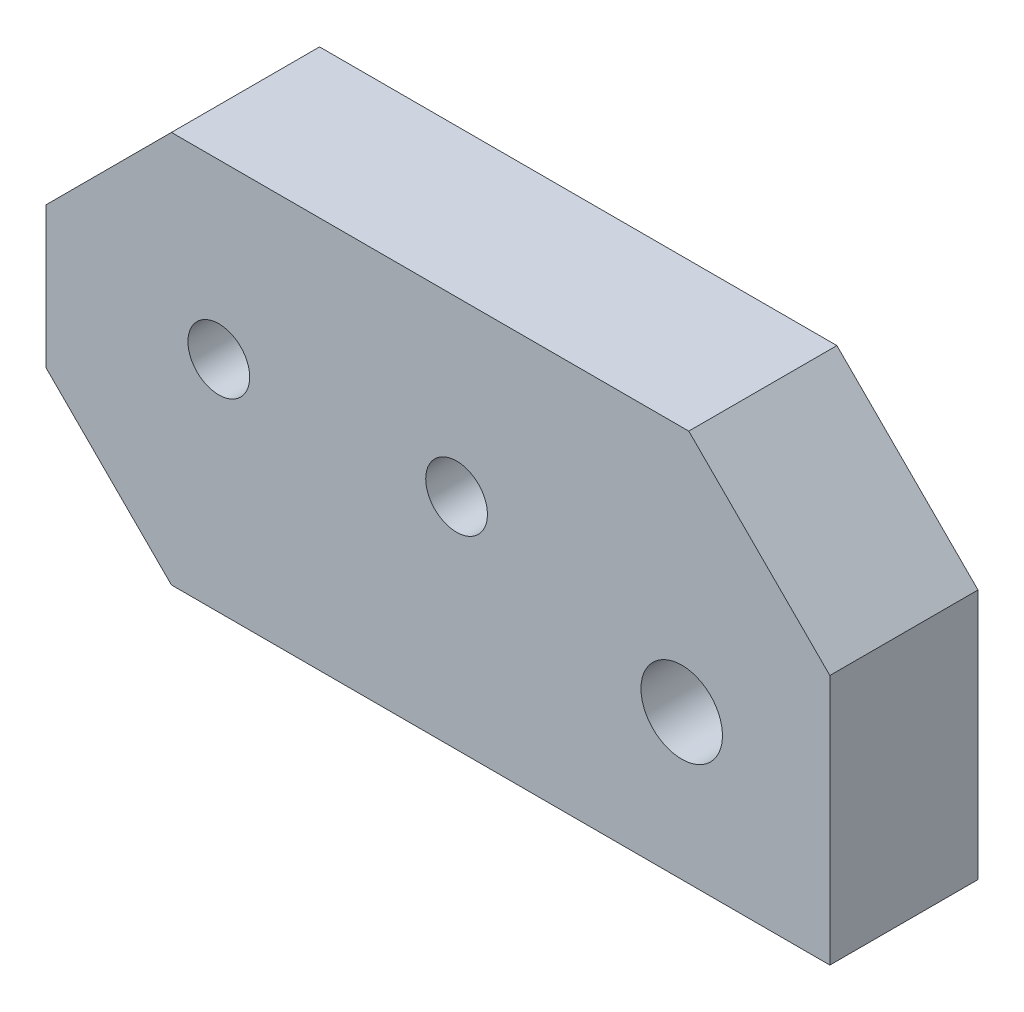
from build123d import *

# Parameters (mm, degrees)
BOSS_EXTRUDE1_DEPTH   = 6
M6X1_0_TAPPED_HOLE1_D = 5
M6_CLEARANCE_HOLE1_D  = 6.6


with BuildPart() as part:
    # Sketch2 → Boss-Extrude1 (new, symmetric)
    with BuildSketch(Plane.XY):
        Polygon((31.75, -15.875), (-21.59, -15.875), (-31.75, -5.715), (-31.75, 5.715), (-21.59, 15.875), (20.32, 15.875), (31.75, 4.445), align=None)
    extrude(amount=BOSS_EXTRUDE1_DEPTH, both=True)

    # M6x1.0 Tapped Hole1 (through all)
    with Locations(Plane(origin=(0, 0, -6), x_dir=(-1, 0, 0), z_dir=(0, 0, -1))):
        with Locations((17.75, 1.875), (-1.51, 1.875)):
            Hole(M6X1_0_TAPPED_HOLE1_D / 2)

    # M6 Clearance Hole1 (through all)
    with Locations(Plane(origin=(0, 0, -6), x_dir=(-1, 0, 0), z_dir=(0, 0, -1))):
        with Locations((-19.74843928, -4.125)):
            Hole(M6_CLEARANCE_HOLE1_D / 2)


solid = part.part
